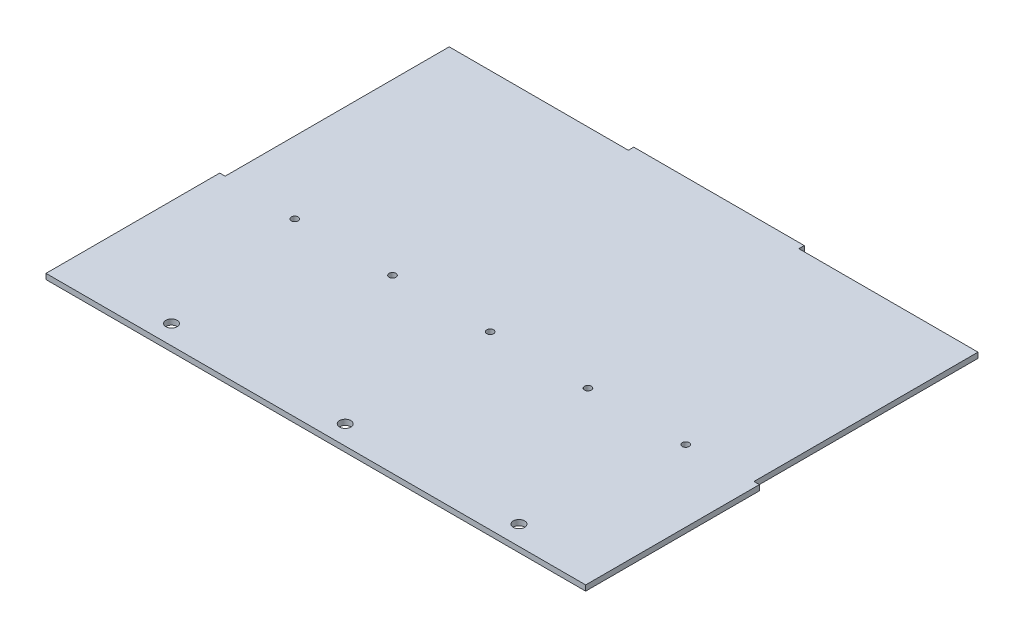
from build123d import *

# Parameters (mm, degrees)
SKETCH1_W           = 315.58
SKETCH1_H           = 3.175
BOSS_EXTRUDE1_DEPTH = 232.600000128
SKETCH5_W           = 3.175
SKETCH5_H           = 130.999992
CUT_EXTRUDE2_DEPTH  = 282.088108579
SKETCH7_R           = 3.302
CUT_EXTRUDE3_DEPTH  = 282.088108579
LPATTERN1_COUNT     = 3
LPATTERN1_PITCH     = 101.6
SKETCH8_R           = 2
CUT_EXTRUDE4_DEPTH  = 282.088108579
LPATTERN2_COUNT     = 5
LPATTERN2_PITCH     = 57.15
SKETCH10_W          = 99.68
SKETCH10_H          = 3.175
BOSS_EXTRUDE2_DEPTH = 3.175


with BuildPart() as part:
    # Sketch1 → Boss-Extrude1 (new body)
    with BuildSketch(Plane.XY):
        Rectangle(SKETCH1_W, SKETCH1_H)
    extrude(amount=BOSS_EXTRUDE1_DEPTH)

    # Sketch5 → Cut-Extrude2 (cut, symmetric)
    with BuildSketch(Plane(origin=(0, 1.5875, 0), x_dir=(1, 0, 0), z_dir=(0, 1, 0))):
        with Locations((-156.2025, -65.499996)):
            Rectangle(SKETCH5_W, SKETCH5_H)
    cut_extrude2 = extrude(amount=CUT_EXTRUDE2_DEPTH, both=True, mode=Mode.SUBTRACT)

    # Mirror1: Cut-Extrude2 across plane
    add(cut_extrude2.mirror(Plane(origin=(0, 0, 0), x_dir=(0, 0, 1), z_dir=(1, 0, 0))), mode=Mode.SUBTRACT)

    # Sketch7 → Cut-Extrude3 (cut, through all)
    with BuildSketch(Plane.XZ.offset(1.5875)):
        with Locations((107.495393219, 221.30835)):
            Circle(SKETCH7_R)
    cut_extrude3 = extrude(amount=-CUT_EXTRUDE3_DEPTH, mode=Mode.SUBTRACT)

    # LPattern1: Cut-Extrude3 ×3
    with Locations(*[(-i * LPATTERN1_PITCH, 0, 0) for i in range(1, LPATTERN1_COUNT)]):
        add(cut_extrude3, mode=Mode.SUBTRACT)

    # Sketch8 → Cut-Extrude4 (cut, through all)
    with BuildSketch(Plane.XZ.offset(1.5875)):
        with Locations((-112.632892956, 132.28750022)):
            Circle(SKETCH8_R)
    cut_extrude4 = extrude(amount=-CUT_EXTRUDE4_DEPTH, mode=Mode.SUBTRACT)

    # LPattern2: Cut-Extrude4 ×5
    with Locations(*[(i * LPATTERN2_PITCH, 0, 0) for i in range(1, LPATTERN2_COUNT)]):
        add(cut_extrude4, mode=Mode.SUBTRACT)

    # Sketch10 → Boss-Extrude2 (add)
    with BuildSketch(Plane(origin=(0, 0, 0), x_dir=(-1, 0, 0), z_dir=(0, 0, -1))):
        Rectangle(SKETCH10_W, SKETCH10_H)
    extrude(amount=BOSS_EXTRUDE2_DEPTH)


solid = part.part
